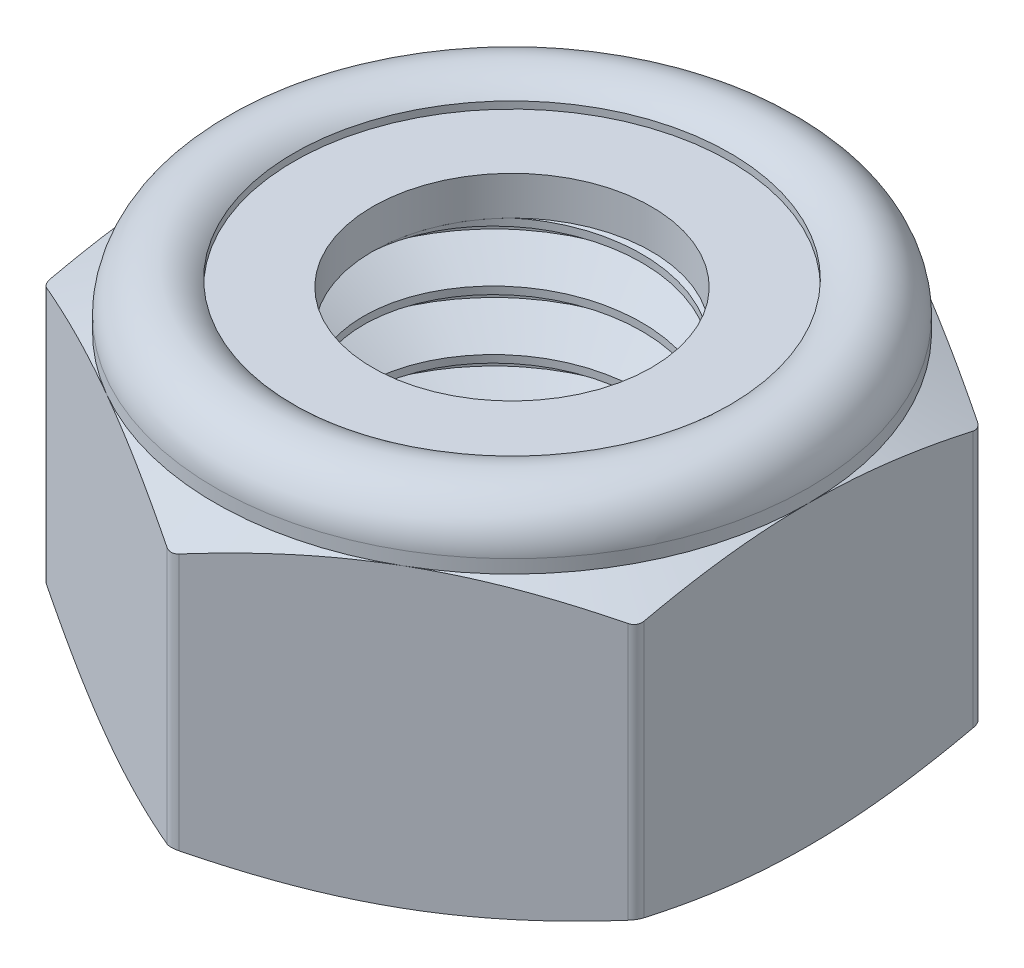
from build123d import *

# Parameters (mm, degrees)
BOSS_EXTRUDE1_DEPTH      = 3
BOSS_EXTRUDE1_DEPTH_BACK = 3
SKETCH2_R                = 2.350480947
FILLET1_R                = 0.2
SKETCH4_W                = 1.324759527
SKETCH4_H                = 0.652707199
SKETCH6_W                = 3
SKETCH6_H                = 5
CUT_SWEEP1_PITCH         = 1
SKETCH10_R               = 2.950480947
BOSS_EXTRUDE2_DEPTH      = 5


with BuildPart() as part:
    # Sketch2 → Boss-Extrude1 (new, two sides: drawn at the far end of the back side and taken through both)
    with BuildSketch(Plane(origin=(0, 0, 0), x_dir=(1, 0, 0), z_dir=(0, 1, 0)).offset(-BOSS_EXTRUDE1_DEPTH_BACK)):
        Polygon((0, 5.773502692), (-5, 2.886751346), (-5, -2.886751346), (0, -5.773502692), (5, -2.886751346), (5, 2.886751346), align=None)
        with Locations(Location((0, 0, 0), (0, 0, 270))):
            Circle(SKETCH2_R, mode=Mode.SUBTRACT)
    extrude(amount=BOSS_EXTRUDE1_DEPTH + BOSS_EXTRUDE1_DEPTH_BACK)

    # Fillet1
    fillet1_edges = [part.edges().sort_by_distance(p)[0] for p in [
        (5, 0, -2.886751346),
        (5, 0, 2.886751346),
        (0, 0, 5.773502692),
        (-5, 0, 2.886751346),
        (-5, 0, -2.886751346),
        (0, 0, -5.773502692),
    ]]
    fillet(fillet1_edges, radius=FILLET1_R)

    # Sketch3 → Cut-Revolve2 (revolve, cut)
    with BuildSketch(Plane(origin=(0, 0, 0), x_dir=(0, 0, -1), z_dir=(1, 0, 0)), mode=Mode.PRIVATE) as cut_revolve2_sk:
        with BuildLine():
            Line((5.773502692, 2), (5.773502692, 4))
            Line((5.773502692, 4), (2.350480947, 4))
            Line((2.350480947, 4), (2.350480947, 2))
            Line((2.350480947, 2), (3.675240474, 2))
            Line((3.675240474, 2), (3.675240474, 2.772707199))
            ThreePointArc((3.675240474, 2.772707199), (4.520946192, 2.940928526), (5, 2.223973836))
            Line((5, 2.223973836), (5, 2))
            Line((5, 2), (5.773502692, 1.639309771))
            Line((5.773502692, 1.639309771), (5.773502692, 2))
        make_face()
        Polygon((5, -3), (5.773502692, -2.639309771), (5.773502692, -3), align=None)
        Polygon((2.350480947, -3), (2.350480947, -2.4), (2.950480947, -3), align=None)
    revolve(cut_revolve2_sk.sketch.rotate(Axis((0, -3, 0), (0, 1, 0)), 270), axis=Axis((0, -3, 0), (0, 1, 0)), mode=Mode.SUBTRACT)

    # Sketch10 → Boss-Extrude2 (add)
    with BuildSketch(Plane.XZ.offset(3)):
        Circle(SKETCH10_R)
    extrude(amount=-BOSS_EXTRUDE2_DEPTH)


with BuildPart() as body_2:
    # Sketch4 → Revolve1 (revolve)
    with BuildSketch(Plane(origin=(0, 0, 0), x_dir=(0, 0, -1), z_dir=(1, 0, 0)), mode=Mode.PRIVATE) as revolve1_sk:
        with Locations((-3.012860711, 2.326353599)):
            Rectangle(SKETCH4_W, SKETCH4_H)
    revolve(revolve1_sk.sketch.rotate(Axis((0, -3, 0), (0, 1, 0)), 90), axis=Axis((0, -3, 0), (0, 1, 0)))


with BuildPart() as body_3:
    # Sketch6 → Revolve2 (revolve)
    with BuildSketch(Plane.XY, mode=Mode.PRIVATE) as revolve2_sk:
        with Locations((1.5, -0.5)):
            Rectangle(SKETCH6_W, SKETCH6_H)
    revolve(revolve2_sk.sketch.rotate(Axis((0, -3, 0), (0, 1, 0)), 90), axis=Axis((0, -3, 0), (0, 1, 0)))

    # Cut-Sweep1: the profile of Sketch8 profile screwed along a right-hand helix of 6 turns, 8 arcs to a turn; built about Z, then put on its axis
    cut_sweep1_z = Axis((0, 0, 0), (0, 0, 1))
    cut_sweep1_corners = [(2.350180947, 0, -0.375173205), (2.350180947, 0, -0.499826795), (3.054126588, 0, -0.90625), (3.108253175, 0, 0.0625)]
    with BuildLine(mode=Mode.PRIVATE) as cut_sweep1_profile:
        Line(cut_sweep1_corners[0], cut_sweep1_corners[1])
        Line(cut_sweep1_corners[1], cut_sweep1_corners[2])
        Line(cut_sweep1_corners[2], cut_sweep1_corners[3])
        Line(cut_sweep1_corners[3], cut_sweep1_corners[0])
    cut_sweep1_cap = Face(cut_sweep1_profile.wire())
    cut_sweep1_turn_angles = [0, 22.5, 45, 67.5, 90, 112.5, 135, 157.5, 180, 202.5, 225, 247.5, 270, 292.5, 315, 337.5, 360]
    cut_sweep1_turn_weights = [1, 0.9238795325112867, 1, 0.9238795325112867, 1, 0.9238795325112867, 1, 0.9238795325112867, 1, 0.9238795325112867, 1, 0.9238795325112867, 1, 0.9238795325112867, 1, 0.9238795325112867, 1]
    cut_sweep1_turn_rails = [Edge.make_bspline([Vector(p[0], p[1], 0).rotate(cut_sweep1_z, cut_sweep1_turn_angles[k]) / cut_sweep1_turn_weights[k] + Vector(0, 0, p[2] + CUT_SWEEP1_PITCH * cut_sweep1_turn_angles[k] / 360) for k in range(17)], [0, 0, 0, 1, 1, 2, 2, 3, 3, 4, 4, 5, 5, 6, 6, 7, 7, 8, 8, 8], 2, cut_sweep1_turn_weights) for p in cut_sweep1_corners]
    cut_sweep1_turn_sides = [Face.make_surface_from_curves(cut_sweep1_turn_rails[p[0]], cut_sweep1_turn_rails[p[1]]) for p in [(0, 1), (1, 2), (2, 3), (3, 0)]]
    cut_sweep1 = Plane(origin=(0, -3, 0), x_dir=(1, 0, 0), z_dir=(0, 1, 0)) * Solid(Shell([*[p.moved(Location((0, 0, CUT_SWEEP1_PITCH * i))) for i in range(6) for p in cut_sweep1_turn_sides], cut_sweep1_cap, cut_sweep1_cap.rotate(cut_sweep1_z, 2160).moved(Location((0, 0, CUT_SWEEP1_PITCH * 2160 / 360)))]))
    add(cut_sweep1, mode=Mode.SUBTRACT)

    # Sketch9 → Revolve3 (revolve)
    with BuildSketch(Plane.XY, mode=Mode.PRIVATE) as revolve3_sk:
        Polygon((0, 0), (0, -3), (3, -3), (3.6, -3), (0, 0.6), align=None)
    revolve(revolve3_sk.sketch.rotate(Axis((0, 0, 0), (0, -1, 0)), 90.182506618), axis=Axis((0, 0, 0), (0, -1, 0)))


with BuildPart() as part_1:
    add(part.part)

    # Combine1: cut body 3
    add(body_3.part, mode=Mode.SUBTRACT)


solid = Compound([body_2.part, part_1.part])
